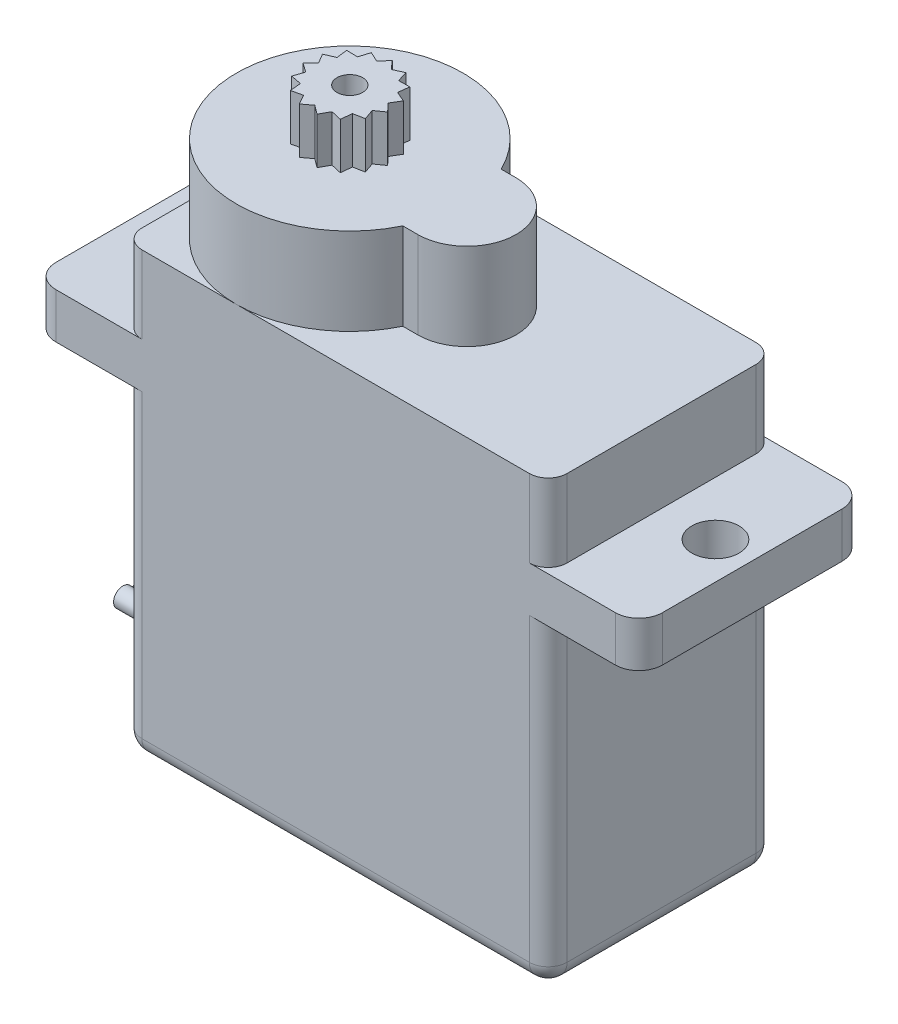
from build123d import *

# Parameters (mm, degrees)
BOSS_EXTRUDE1_DEPTH = 6
BOSS_EXTRUDE3_DEPTH = 4.6
SKETCH6_R           = 0.68
BOSS_EXTRUDE4_DEPTH = 2.45
SKETCH2_R           = 1.25
CUT_EXTRUDE6_DEPTH  = 10
FILLET1_R           = 1
FILLET2_R           = 1.25
BOSS_EXTRUDE5_DEPTH = 5


with BuildPart() as part:
    # Sketch1 → Boss-Extrude1 (new, symmetric)
    with BuildSketch(Plane.XY):
        Polygon((0, 0), (0, 16.9), (-4.8, 16.9), (-4.8, 19.3), (0, 19.3), (0, 23.4), (22.5, 23.4), (22.5, 19.3), (27.3, 19.3), (27.3, 16.9), (22.5, 16.9), (22.5, 0), align=None)
    extrude(amount=BOSS_EXTRUDE1_DEPTH, both=True)

    # Sketch5 → Boss-Extrude3 (add)
    with BuildSketch(Plane(origin=(0, 23.4, 0), x_dir=(1, 0, 0), z_dir=(0, 1, 0))):
        with BuildLine():
            Line((12.2, 2.6), (11.407402334, 2.6))
            ThreePointArc((11.407402334, 2.6), (0, 0), (11.407402334, -2.6))
            Line((11.407402334, -2.6), (12.2, -2.6))
            ThreePointArc((12.2, -2.6), (14.8, 0), (12.2, 2.6))
        make_face()
    extrude(amount=BOSS_EXTRUDE3_DEPTH)

    # Sketch6 → Boss-Extrude4 (add)
    with BuildSketch(Plane(origin=(0, 28, 0), x_dir=(1, 0, 0), z_dir=(0, 1, 0))):
        Polygon((5.615363372, 1.809573061), (6, 2.25), (6.384636628, 1.809573061), (6.915157447, 2.05547728), (7.087402717, 1.49668144), (7.672075857, 1.505543864), (7.602146997, 0.925), (8.139877162, 0.695288237), (7.839865506, 0.193377657), (8.237674265, -0.235189042), (7.759454555, -0.57168144), (7.948557159, -1.125), (7.374817927, -1.237891622), (7.322516818, -1.820288237), (6.75246279, -1.690059097), (6.467801304, -2.200832102), (6, -1.85), (5.532198696, -2.200832102), (5.24753721, -1.690059097), (4.677483182, -1.820288237), (4.625182073, -1.237891622), (4.051442841, -1.125), (4.240545445, -0.57168144), (3.762325735, -0.235189042), (4.160134494, 0.193377657), (3.860122838, 0.695288237), (4.397853003, 0.925), (4.327924143, 1.505543864), (4.912597283, 1.49668144), (5.084842553, 2.05547728), align=None)
        with Locations((6, 0)):
            Circle(SKETCH6_R, mode=Mode.SUBTRACT)
    extrude(amount=BOSS_EXTRUDE4_DEPTH)

    # Sketch2 → Cut-Extrude6 (cut)
    with BuildSketch(Plane(origin=(0, 19.3, 0), x_dir=(1, 0, 0), z_dir=(0, 1, 0))):
        with Locations((-2.85, 0)):
            Circle(SKETCH2_R)
        with Locations((25.35, 0)):
            Circle(SKETCH2_R)
    extrude(amount=-CUT_EXTRUDE6_DEPTH, mode=Mode.SUBTRACT)

    # Fillet1
    fillet1_edges = [part.edges().sort_by_distance(p)[0] for p in [
        (0, 0, 0),
        (11.25, 0, 6),
        (22.5, 0, 0),
        (11.25, 0, -6),
        (0, 8.45, -6),
        (0, 21.35, -6),
        (0, 8.45, 6),
        (0, 21.35, 6),
        (22.5, 21.35, 6),
        (22.5, 21.35, -6),
        (22.5, 8.45, -6),
        (22.5, 8.45, 6),
    ]]
    fillet(fillet1_edges, radius=FILLET1_R)

    # Fillet2
    fillet2_edges = [part.edges().sort_by_distance(p)[0] for p in [
        (27.3, 18.1, -6),
        (-4.8, 18.1, -6),
        (-4.8, 18.1, 6),
        (27.3, 18.1, 6),
    ]]
    fillet(fillet2_edges, radius=FILLET2_R)

    # Sketch7 → Boss-Extrude5 (add)
    with BuildSketch(Plane.ZY):
        with BuildLine():
            Line((-0.543660539, 2.20433868), (-0.456339461, 2.20433868))
            ThreePointArc((-0.456339461, 2.20433868), (0, 2.5), (0.456339461, 2.20433868))
            Line((0.456339461, 2.20433868), (0.543660539, 2.20433868))
            ThreePointArc((0.543660539, 2.20433868), (1.5, 2), (0.543660539, 1.79566132))
            Line((0.543660539, 1.79566132), (0.456339461, 1.79566132))
            ThreePointArc((0.456339461, 1.79566132), (0, 1.5), (-0.456339461, 1.79566132))
            Line((-0.456339461, 1.79566132), (-0.543660539, 1.79566132))
            ThreePointArc((-0.543660539, 1.79566132), (-1.5, 2), (-0.543660539, 2.20433868))
        make_face()
    extrude(amount=BOSS_EXTRUDE5_DEPTH)


solid = part.part
